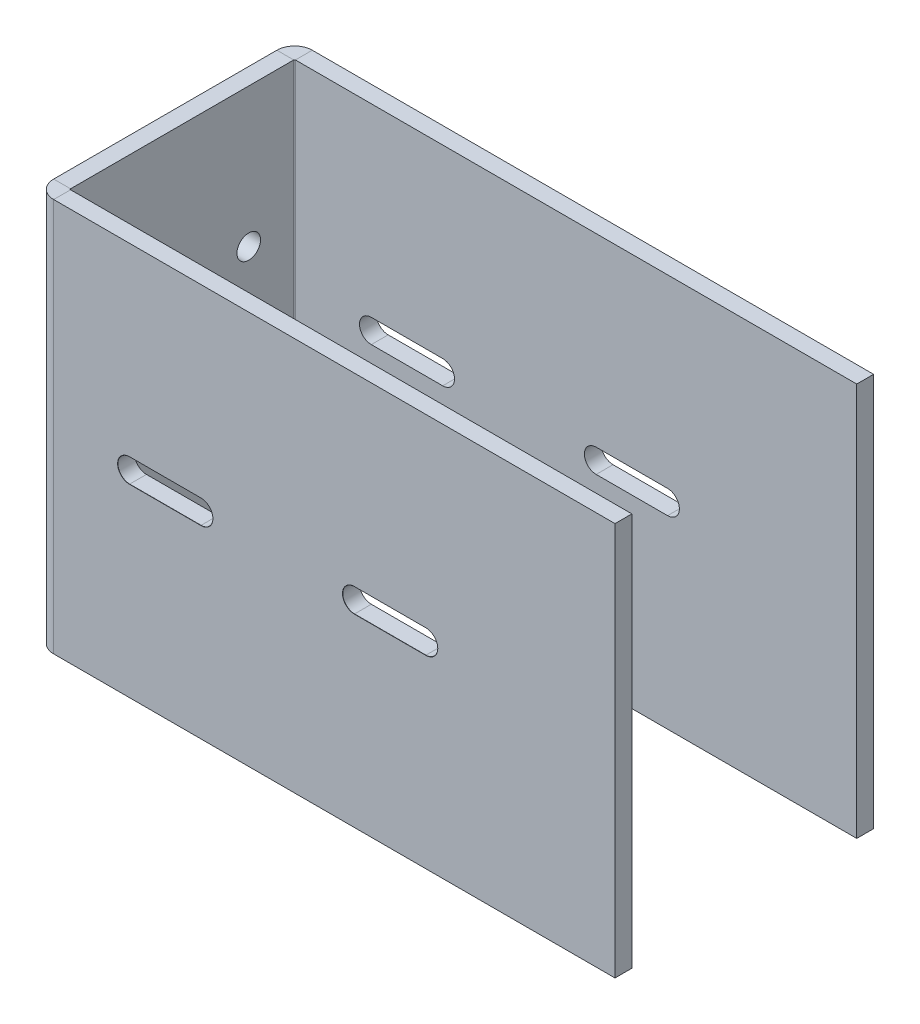
from build123d import *

# Parameters (mm, degrees)
SKETCH1_W                         = 100
SKETCH1_H                         = 70
BASE_FLANGE1_DEPTH                = 3
EDGE_FLANGE1_STRIP_W              = 12.3
EDGE_FLANGE1_STRIP_H              = 3
EDGE_FLANGE1_STRIP_CUT_DEPTH      = 70
EDGE_FLANGE1_DEPTH                = 70
EDGE_FLANGE3_STRIP_W              = 12.3
EDGE_FLANGE3_STRIP_H              = 3
EDGE_FLANGE3_STRIP_CUT_DEPTH      = 70
EDGE_FLANGE3_DEPTH                = 70
TAP_START                         = -47
TAP_DRILL_SLOT_FOR_M5_TAP3_DEPTH  = 48
TAP_DRILL_FOR_M5_TAP1_D           = 4.2
TAP_DRILL_FOR_M5_TAP1_CSINK_D     = 4.25
TAP_DRILL_FOR_M5_TAP1_CSINK_ANGLE = 90


with BuildPart() as part:
    # Base-Flange1: sheet metal written as solids
    # Sketch1 → Base-Flange1 (new body)
    with BuildSketch(Plane.XY):
        with Locations((9.007487246, 428.98845549)):
            Rectangle(SKETCH1_W, SKETCH1_H)
    extrude(amount=-BASE_FLANGE1_DEPTH)

    # Edge-Flange1: sheet metal written as solids
    # Edge-Flange1 strip (on a plane across the edge) → Edge-Flange1 strip cut (cut)
    with BuildSketch(Plane(origin=(-40.992512754, 393.98845549, -3), x_dir=(1, 0, 0), z_dir=(0, 1, 0))):
        with Locations((-6, -1.5)):
            Rectangle(EDGE_FLANGE1_STRIP_W, EDGE_FLANGE1_STRIP_H)
    extrude(amount=EDGE_FLANGE1_STRIP_CUT_DEPTH, mode=Mode.SUBTRACT)

    # Edge-Flange1 section (on a plane across the edge) → Edge-Flange1 (add)
    with BuildSketch(Plane(origin=(-40.992512754, 393.98845549, -3), x_dir=(1, 0, 0), z_dir=(0, 1, 0))):
        with BuildLine():
            Line((-3, 0.15), (-3, 40))
            Line((-3, 40), (0, 40))
            Line((0, 40), (0, 0.15))
            ThreePointArc((0, 0.15), (0.043933983, 0.043933983), (0.15, 0))
            Line((0.15, 0), (0.15, -3))
            ThreePointArc((0.15, -3), (-2.077386361, -2.077386361), (-3, 0.15))
        make_face()
    extrude(amount=EDGE_FLANGE1_DEPTH)

    # Edge-Flange3: sheet metal written as solids
    # Edge-Flange3 strip (on a plane across the edge) → Edge-Flange3 strip cut (cut)
    with BuildSketch(Plane(origin=(-40.992512754, 393.98845549, -43), x_dir=(0, 0, 1), z_dir=(0, 1, 0))):
        with Locations((-6, -1.5)):
            Rectangle(EDGE_FLANGE3_STRIP_W, EDGE_FLANGE3_STRIP_H)
    extrude(amount=EDGE_FLANGE3_STRIP_CUT_DEPTH, mode=Mode.SUBTRACT)

    # Edge-Flange3 section (on a plane across the edge) → Edge-Flange3 (add)
    with BuildSketch(Plane(origin=(-40.992512754, 393.98845549, -43), x_dir=(0, 0, 1), z_dir=(0, 1, 0))):
        with BuildLine():
            Line((-3, 0.15), (-3, 100))
            Line((-3, 100), (0, 100))
            Line((0, 100), (0, 0.15))
            ThreePointArc((0, 0.15), (0.043933983, 0.043933983), (0.15, 0))
            Line((0.15, 0), (0.15, -3))
            ThreePointArc((0.15, -3), (-2.077386361, -2.077386361), (-3, 0.15))
        make_face()
    extrude(amount=EDGE_FLANGE3_DEPTH)

    # Tap Drill Slot for M5 Tap3: read off the stored shape, not the designer's step
    # Tap Drill Slot for M5 Tap3 outline → Tap Drill Slot for M5 Tap3 (cut)
    with BuildSketch(Plane.XY.offset(TAP_START)):
        with BuildLine():
            ThreePointArc((12.657487246, 431.08845549), (10.557487246, 428.98845549), (12.657487246, 426.88845549))
            Line((12.657487246, 426.88845549), (25.357487246, 426.88845549))
            ThreePointArc((25.357487246, 426.88845549), (27.457487246, 428.98845549), (25.357487246, 431.08845549))
            Line((25.357487246, 431.08845549), (12.657487246, 431.08845549))
        make_face()
        with BuildLine():
            ThreePointArc((-27.342512754, 431.08845549), (-29.442512754, 428.98845549), (-27.342512754, 426.88845549))
            Line((-27.342512754, 426.88845549), (-14.642512754, 426.88845549))
            ThreePointArc((-14.642512754, 426.88845549), (-12.542512754, 428.98845549), (-14.642512754, 431.08845549))
            Line((-14.642512754, 431.08845549), (-27.342512754, 431.08845549))
        make_face()
    extrude(amount=TAP_DRILL_SLOT_FOR_M5_TAP3_DEPTH, mode=Mode.SUBTRACT)

    # Tap Drill Slot for M5 Tap3 2: loft between two sections, ruled curve by curve
    tap_drill_slot_for_m5_tap3_2_from = [
        Edge.make_three_point_arc((25.357487246, 426.88845549, -0.025), (26.842411487, 427.503531249, -0.025), (27.457487246, 428.98845549, -0.025)),
        Edge.make_three_point_arc((27.457487246, 428.98845549, -0.025), (26.842411487, 430.47337973, -0.025), (25.357487246, 431.08845549, -0.025)),
        Edge.make_three_point_arc((12.657487246, 431.08845549, -0.025), (11.172563006, 430.47337973, -0.025), (10.557487246, 428.98845549, -0.025)),
        Edge.make_three_point_arc((10.557487246, 428.98845549, -0.025), (11.172563006, 427.503531249, -0.025), (12.657487246, 426.88845549, -0.025)),
        Edge.make_line((25.357487246, 431.08845549, -0.025), (12.657487246, 431.08845549, -0.025)),
        Edge.make_line((25.357487246, 426.88845549, -0.025), (12.657487246, 426.88845549, -0.025)),
    ]
    tap_drill_slot_for_m5_tap3_2_to = [
        Edge.make_three_point_arc((25.357487246, 426.86345549, 0), (26.860089156, 427.48585358, 0), (27.482487246, 428.98845549, 0)),
        Edge.make_three_point_arc((27.482487246, 428.98845549, 0), (26.860089156, 430.4910574, 0), (25.357487246, 431.11345549, 0)),
        Edge.make_three_point_arc((12.657487246, 431.11345549, 0), (11.154885336, 430.4910574, 0), (10.532487246, 428.98845549, 0)),
        Edge.make_three_point_arc((10.532487246, 428.98845549, 0), (11.154885336, 427.48585358, 0), (12.657487246, 426.86345549, 0)),
        Edge.make_line((25.357487246, 431.11345549, 0), (12.657487246, 431.11345549, 0)),
        Edge.make_line((25.357487246, 426.86345549, 0), (12.657487246, 426.86345549, 0)),
    ]
    tap_drill_slot_for_m5_tap3_2 = Solid(Shell([*[Face.make_surface_from_curves(tap_drill_slot_for_m5_tap3_2_from[k], tap_drill_slot_for_m5_tap3_2_to[k]) for k in range(6)], Face(Wire(tap_drill_slot_for_m5_tap3_2_from)), Face(Wire(tap_drill_slot_for_m5_tap3_2_to))]))
    add(tap_drill_slot_for_m5_tap3_2, mode=Mode.SUBTRACT)

    # Tap Drill Slot for M5 Tap3 3: loft between two sections, ruled curve by curve
    tap_drill_slot_for_m5_tap3_3_from = [
        Edge.make_three_point_arc((-14.642512754, 426.88845549, -0.025), (-13.157588513, 427.503531249, -0.025), (-12.542512754, 428.98845549, -0.025)),
        Edge.make_three_point_arc((-12.542512754, 428.98845549, -0.025), (-13.157588513, 430.47337973, -0.025), (-14.642512754, 431.08845549, -0.025)),
        Edge.make_three_point_arc((-27.342512754, 431.08845549, -0.025), (-28.827436994, 430.47337973, -0.025), (-29.442512754, 428.98845549, -0.025)),
        Edge.make_three_point_arc((-29.442512754, 428.98845549, -0.025), (-28.827436994, 427.503531249, -0.025), (-27.342512754, 426.88845549, -0.025)),
        Edge.make_line((-14.642512754, 431.08845549, -0.025), (-27.342512754, 431.08845549, -0.025)),
        Edge.make_line((-14.642512754, 426.88845549, -0.025), (-27.342512754, 426.88845549, -0.025)),
    ]
    tap_drill_slot_for_m5_tap3_3_to = [
        Edge.make_three_point_arc((-14.642512754, 426.86345549, 0), (-13.139910844, 427.48585358, 0), (-12.517512754, 428.98845549, 0)),
        Edge.make_three_point_arc((-12.517512754, 428.98845549, 0), (-13.139910844, 430.4910574, 0), (-14.642512754, 431.11345549, 0)),
        Edge.make_three_point_arc((-27.342512754, 431.11345549, 0), (-28.845114664, 430.4910574, 0), (-29.467512754, 428.98845549, 0)),
        Edge.make_three_point_arc((-29.467512754, 428.98845549, 0), (-28.845114664, 427.48585358, 0), (-27.342512754, 426.86345549, 0)),
        Edge.make_line((-14.642512754, 431.11345549, 0), (-27.342512754, 431.11345549, 0)),
        Edge.make_line((-14.642512754, 426.86345549, 0), (-27.342512754, 426.86345549, 0)),
    ]
    tap_drill_slot_for_m5_tap3_3 = Solid(Shell([*[Face.make_surface_from_curves(tap_drill_slot_for_m5_tap3_3_from[k], tap_drill_slot_for_m5_tap3_3_to[k]) for k in range(6)], Face(Wire(tap_drill_slot_for_m5_tap3_3_from)), Face(Wire(tap_drill_slot_for_m5_tap3_3_to))]))
    add(tap_drill_slot_for_m5_tap3_3, mode=Mode.SUBTRACT)

    # Tap Drill for M5 Tap1 (through all)
    with Locations(Plane.ZY.offset(43.992512754)):
        with Locations((-34.85, 439.23845549), (-11.15, 439.23845549), (-11.15, 418.73845549), (-34.85, 418.73845549)):
            CounterSinkHole(TAP_DRILL_FOR_M5_TAP1_D / 2, TAP_DRILL_FOR_M5_TAP1_CSINK_D / 2, counter_sink_angle=TAP_DRILL_FOR_M5_TAP1_CSINK_ANGLE)


solid = part.part
